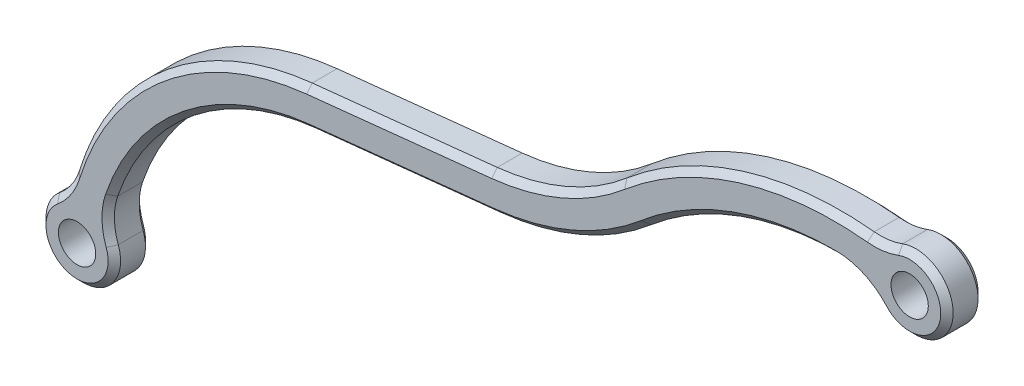
from build123d import *

# Parameters (mm, degrees)
SKETCH1_R             = 3
SKETCH1_R_2           = 1.5
BOSS_EXTRUDE1_DEPTH   = 3
BOSS_EXTRUDE1_2_DEPTH = 3
EXTRUDE_THIN1_DEPTH   = 3
FILLET1_R             = 5
CHAMFER1_SIZE         = 0.5


with BuildPart() as part:
    # Sketch1 → Boss-Extrude1 (new body)
    with BuildSketch(Plane.XY):
        with Locations((-17, 9.92820323)):
            Circle(SKETCH1_R)
        with Locations((-17, 9.92820323)):
            Circle(SKETCH1_R_2, mode=Mode.SUBTRACT)
    extrude(amount=BOSS_EXTRUDE1_DEPTH)



with BuildPart() as body_2:
    # Sketch1 → Boss-Extrude1 2 (new body)
    with BuildSketch(Plane.XY):
        with Locations((-83.950540957, -19.912145865)):
            Circle(SKETCH1_R)
        with Locations((-83.950540957, -19.912145865)):
            Circle(SKETCH1_R_2, mode=Mode.SUBTRACT)
    extrude(amount=BOSS_EXTRUDE1_2_DEPTH)


with BuildPart() as part_1:
    add(part.part)

    add(body_2.part)  # Extrude-Thin1 merges body 2
    # Sketch2 → Extrude-Thin1 (add)
    with BuildSketch(Plane.XY):
        with BuildLine():
            ThreePointArc((-81.866086482, -18.096227729), (-76.0782564, -7.689979577), (-65.226210809, -2.788746653))
            Line((-65.226210809, -2.788746653), (-50.342422521, -1.224397467))
            ThreePointArc((-50.342422521, -1.224397467), (-43.92427654, 0.448702034), (-38.289233854, 3.947009295))
            ThreePointArc((-38.289233854, 3.947009295), (-29.303097517, 8.716235486), (-19.143567587, 9.245495681))
            Line((-19.143567587, 9.245495681), (-18.648168411, 12.204309575))
            ThreePointArc((-18.648168411, 12.204309575), (-30.10325921, 11.607557202), (-40.235323233, 6.230151019))
            ThreePointArc((-40.235323233, 6.230151019), (-45.107146333, 3.205660332), (-50.65600791, 1.759168219))
            Line((-50.65600791, 1.759168219), (-65.539796199, 0.194819033))
            ThreePointArc((-65.539796199, 0.194819033), (-78.10933943, -5.482106907), (-84.813179718, -17.535298624))
            Line((-84.813179718, -17.535298624), (-81.866086482, -18.096227729))
        make_face()
    extrude(amount=EXTRUDE_THIN1_DEPTH)

    # Fillet1
    fillet1_edges = [part_1.edges().sort_by_distance(p)[0] for p in [
        (-84.706300556, -17.008901571, 1.5),
        (-81.809477217, -17.810754407, 1.5),
        (-19.94680617, 9.365767994, 1.5),
        (-18.904716374, 12.245972748, 1.5),
    ]]
    fillet(fillet1_edges, radius=FILLET1_R)

    # Chamfer1
    chamfer1_edges = [part_1.edges().sort_by_distance(p)[0] for p in [
        (-31.106705209, 8.137983689, 0),
        (-43.92427654, 0.448702034, 0),
        (-57.784316665, -2.00657206, 0),
        (-75.062303692, -6.819526639, 0),
        (-30.92519874, 11.365731626, 0),
        (-81.450241332, -17.19340927, 0),
        (-45.107146333, 3.205660332, 0),
        (-84.737508384, -22.807086671, 0),
        (-58.097902055, 0.976993626, 0),
        (-84.860623121, -16.505866782, 0),
        (-77.195374918, -4.686748809, 0),
        (-31.106705209, 8.137983689, 3),
        (-43.92427654, 0.448702034, 3),
        (-57.784316665, -2.00657206, 3),
        (-75.062303692, -6.819526639, 3),
        (-30.92519874, 11.365731626, 3),
        (-81.450241332, -17.19340927, 3),
        (-45.107146333, 3.205660332, 3),
        (-84.737508384, -22.807086671, 3),
        (-58.097902055, 0.976993626, 3),
        (-84.860623121, -16.505866782, 3),
        (-77.195374918, -4.686748809, 3),
        (-20.896879636, 9.132244106, 0),
        (-14.083717416, 9.224430618, 0),
        (-19.18823543, 12.449634759, 0),
        (-20.896879636, 9.132244106, 3),
        (-14.083717416, 9.224430618, 3),
        (-19.18823543, 12.449634759, 3),
    ]]
    chamfer(chamfer1_edges, length=CHAMFER1_SIZE)


solid = part_1.part
